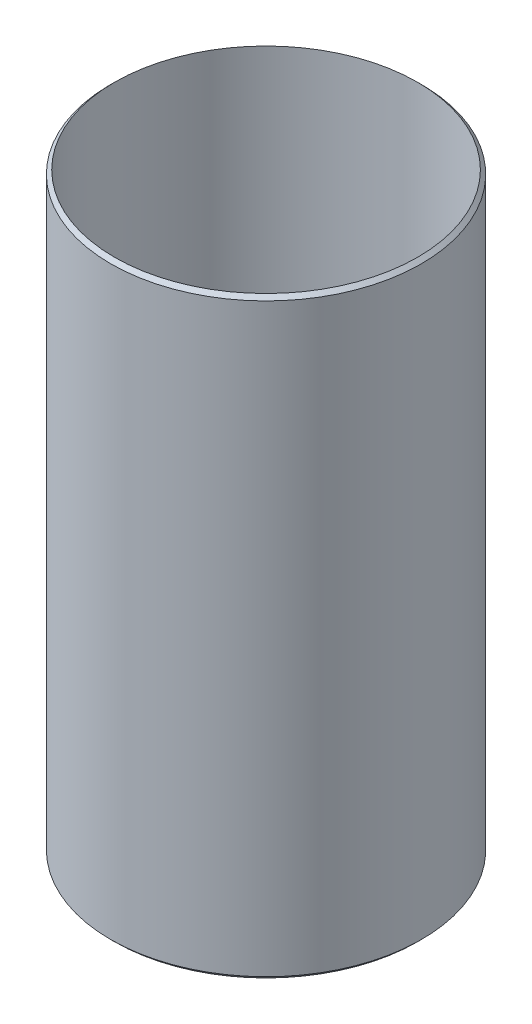
from build123d import *

# Parameters (mm, degrees)
SKETCH1_R           = 82.55
SKETCH1_R_2         = 80.55
BOSS_EXTRUDE1_DEPTH = 315
CHAMFER1_SIZE       = 2


with BuildPart() as part:
    # Sketch1 → Boss-Extrude1 (new body)
    with BuildSketch(Plane(origin=(0, 0, 0), x_dir=(1, 0, 0), z_dir=(0, 1, 0))):
        with Locations(Location((0, 0, 0), (0, 0, 270))):
            Circle(SKETCH1_R)
        with Locations(Location((0, 0, 0), (0, 0, 270))):
            Circle(SKETCH1_R_2, mode=Mode.SUBTRACT)
    extrude(amount=BOSS_EXTRUDE1_DEPTH)

    # Chamfer1
    chamfer1_edges = [part.edges().sort_by_distance(p)[0] for p in [
        (0, 0, -82.55),
        (0, 315, -82.55),
    ]]
    chamfer(chamfer1_edges, length=CHAMFER1_SIZE - 0.0001)  # a hair under: the kernel refuses the full size


solid = part.part
